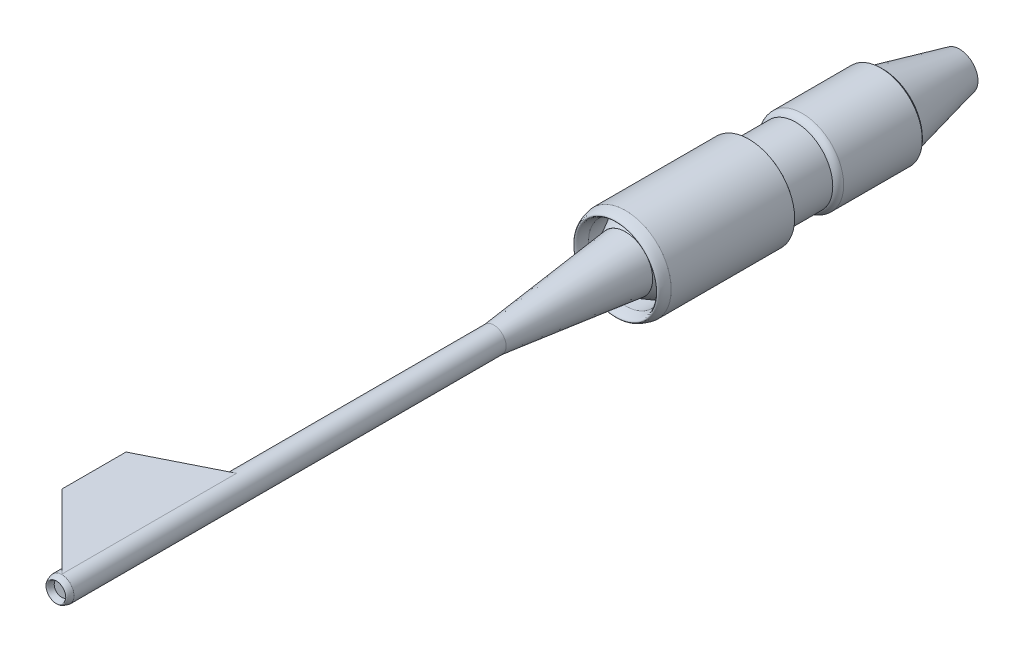
from build123d import *
from build123d.topology import SkipClean

# Parameters (mm, degrees)
SKETCH1_R           = 416.25
SKETCH1_R_2         = 337.5
BOSS_EXTRUDE1_DEPTH = 1125
SKETCH5_R           = 112.5
BOSS_EXTRUDE2_DEPTH = 3937.5
SKETCH15_R          = 337.5
BOSS_EXTRUDE5_DEPTH = 486
SKETCH16_R          = 376.875
BOSS_EXTRUDE6_DEPTH = 716
BOSS_EXTRUDE7_DEPTH = 50


with BuildPart() as part:
    # Sketch1 → Boss-Extrude1 (new body)
    with BuildSketch(Plane.XY):
        Circle(SKETCH1_R)
        Circle(SKETCH1_R_2, mode=Mode.SUBTRACT)
    extrude(amount=-BOSS_EXTRUDE1_DEPTH)

    # Sketch2 → Revolve1 (revolve)
    with BuildSketch(Plane(origin=(0, 0, 0), x_dir=(0, 0, -1), z_dir=(1, 0, 0))):
        with BuildLine():
            Line((0, 416.25), (0, 337.5))
            add(Edge.make_bspline(
                [(0, 337.5), (-180, 376.875), (0, 416.25)],
                knots=[0, 0, 0, 1, 1, 1], degree=2))
        make_face()
    revolve(axis=Axis((0, 0, 0), (0, 0, -1)))

    # Sketch18 → Revolve6 (revolve)
    with BuildSketch(Plane(origin=(0, 0, 0), x_dir=(0, 0, -1), z_dir=(1, 0, 0))):
        Polygon((0, 247.5), (306.632414301, 416.25), (306.632414301, 247.5), align=None)
    revolve(axis=Axis((0, 0, 0), (0, 0, -1)))



with BuildPart() as body_2:
    # Sketch4 → Revolve2 (revolve)
    with BuildSketch(Plane(origin=(0, 0, 0), x_dir=(1, 0, 0), z_dir=(0, 1, 0))):
        Polygon((0, 0), (0, -1200), (112.5, -1200), (247.5, 0), align=None)
    revolve(axis=Axis((0, 0, 0), (0, 0, 1)))

    # Sketch5 → Boss-Extrude2 (add)
    with BuildSketch(Plane.XY.offset(1200)):
        Circle(SKETCH5_R)
    extrude(amount=BOSS_EXTRUDE2_DEPTH)

    # Sketch14 → Revolve4 (revolve)
    with BuildSketch(Plane(origin=(0, 0, 0), x_dir=(0, 0, -1), z_dir=(1, 0, 0))):
        with BuildLine():
            Line((-5137.5, 90), (-5137.5, 112.5))
            add(Edge.make_bspline(
                [(-5137.5, 67.5), (-5237.5, 90), (-5137.5, 112.5)],
                knots=[0, 0, 0, 1, 1, 1], degree=2))
            Line((-5137.5, 67.5), (-5137.5, 90))
        make_face()
    revolve(axis=Axis((0, 0, 5137.5), (0, 0, 1)))

    # Sketch22 → Boss-Extrude7 (add)
    with BuildSketch(Plane(origin=(0, 112.486092048, 0), x_dir=(1, 0, 0), z_dir=(0, 1, 0))):
        Polygon((1.768925034, -5137.5), (1.768925034, -3540), (-673.231074966, -3877.5), (-673.231074966, -4462.5), align=None)
    extrude(amount=-BOSS_EXTRUDE7_DEPTH)


with BuildPart() as body_3:
    # Sketch15 → Boss-Extrude5 (new body)
    with BuildSketch(Plane(origin=(0, 0, -1125), x_dir=(-1, 0, 0), z_dir=(0, 0, -1))):
        Circle(SKETCH15_R)
    extrude(amount=BOSS_EXTRUDE5_DEPTH)

    # Sketch16 → Boss-Extrude6 (add)
    with BuildSketch(Plane(origin=(0, 0, -1611), x_dir=(-1, 0, 0), z_dir=(0, 0, -1))):
        Circle(SKETCH16_R)
    extrude(amount=BOSS_EXTRUDE6_DEPTH)

    # Sketch17 → Revolve5 (revolve)
    with BuildSketch(Plane(origin=(0, 0, 0), x_dir=(0, 0, -1), z_dir=(1, 0, 0))):
        Polygon((2327, 0), (3043, 0), (3043, 168.75), (2327, 337.5), align=None)
    revolve(axis=Axis((0, 0, -2327), (0, 0, -1)))

    # Sketch19 → Revolve9 (revolve)
    with BuildSketch(Plane(origin=(0, 0, 0), x_dir=(0, 0, -1), z_dir=(1, 0, 0))):
        with BuildLine():
            Line((1611, 337.5), (1551, 337.5))
            ThreePointArc((1551, 337.5), (1575.706535425, 365.253731733), (1611, 376.875))
            Line((1611, 376.875), (1611, 337.5))
        make_face()
    revolve(axis=Axis((0, 0, -1611), (0, 0, 1)))


with BuildPart() as part_1:
    with SkipClean():  # the faces are left unmerged after this step: merging them gives an invalid solid
        add(part.part)

        add(body_3.part)  # Revolve11 merges body 3
        # Sketch20 → Revolve11 (revolve)
        with BuildSketch(Plane(origin=(0, 0, 0), x_dir=(0, 0, -1), z_dir=(1, 0, 0))):
            with BuildLine():
                Line((1125, 337.5), (1125, 416.25))
                add(Edge.make_bspline(
                    [(1155, 337.5), (1155, 382.589285714), (1125, 416.25)],
                    knots=[0, 0, 0, 1, 1, 1], degree=2, weights=[1, 0.806097206, 1]))
                Line((1155, 337.5), (1125, 337.5))
            make_face()
        revolve(axis=Axis((0, 0, -1125), (0, 0, -1)))

    # Sketch21 → Revolve12 (revolve)
    with BuildSketch(Plane(origin=(0, 0, 0), x_dir=(0, 0, -1), z_dir=(1, 0, 0))):
        with BuildLine():
            Line((2327, 337.5), (2327, 376.875))
            add(Edge.make_bspline(
                [(2327, 376.875), (2356.199972531, 357.1875), (2356.199972531, 330.618023234)],
                knots=[0, 0, 0, 1, 1, 1], degree=2, weights=[1, 0.829833158, 1]))
            Line((2356.199972531, 330.618023234), (2327, 337.5))
        make_face()
    revolve(axis=Axis((0, 0, -2327), (0, 0, -1)))


solid = Compound([body_2.part, part_1.part])
